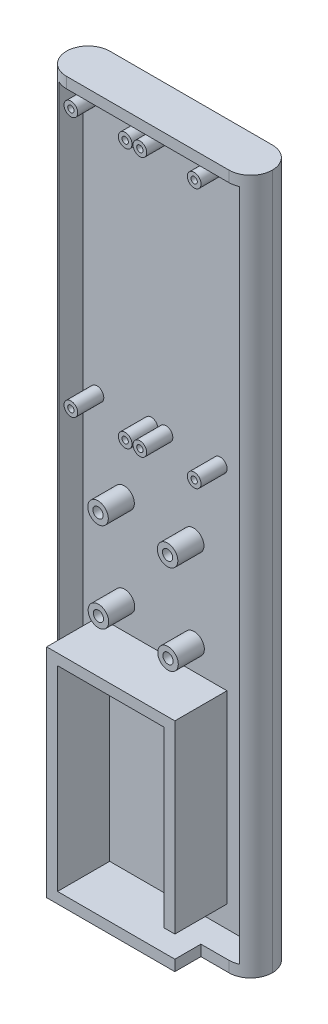
from build123d import *

# Parameters (mm, degrees)
SKETCH1_W           = 63.5
SKETCH1_H           = 203.2
BOSS_EXTRUDE1_DEPTH = 5.08
SKETCH2_R           = 2
SKETCH2_R_2         = 0.925
BOSS_EXTRUDE2_DEPTH = 7.62
BOSS_EXTRUDE3_DEPTH = 15.24
SKETCH4_W           = 3.175
SKETCH4_H           = 6.35
CUT_EXTRUDE1_DEPTH  = 15.24
SKETCH5_R           = 3
SKETCH5_R_2         = 1.5
BOSS_EXTRUDE4_DEPTH = 7.62
SKETCH8_W           = 63.5
SKETCH8_H           = 3.175
SKETCH8_W_2         = 15.305618657
SKETCH8_W_3         = 10.729381343
BOSS_EXTRUDE5_DEPTH = 7.62
SKETCH9_W           = 7.112
SKETCH9_H           = 203.2
CUT_EXTRUDE2_DEPTH  = 255.31730181
SKETCH10_W          = 3.556
SKETCH10_H          = 196.85
BOSS_EXTRUDE6_DEPTH = 7.62
SKETCH11_W          = 12.7
SKETCH11_H          = 203.2
BOSS_EXTRUDE7_DEPTH = 3.81
FILLET1_R           = 6.35


with BuildPart() as part:
    # Sketch1 → Boss-Extrude1 (new body)
    with BuildSketch(Plane.XY):
        with Locations((120.65, 101.6)):
            Rectangle(SKETCH1_W, SKETCH1_H)
    extrude(amount=BOSS_EXTRUDE1_DEPTH)

    # Sketch2 → Boss-Extrude2 (add)
    # profile 1 of 8: a face of its own
    with BuildSketch(Plane.XY.offset(5.08)):
        with Locations(Location((123.8316, 195.58, 0), (0, 0, 180))):
            Circle(SKETCH2_R)
        with Locations(Location((123.8316, 195.58, 0), (0, 0, 180))):
            Circle(SKETCH2_R_2, mode=Mode.SUBTRACT)
    # profile 2 of 8: a face of its own
    with BuildSketch(Plane.XY.offset(5.08)):
        with BuildLine():
            ThreePointArc((139.7, 193.58), (141.114213562, 196.994213562), (137.7, 195.58))
            ThreePointArc((137.7, 195.58), (138.285786438, 194.165786438), (139.7, 193.58))
        make_face()
        with Locations(Location((139.7, 195.58, 0), (0, 0, 180))):
            Circle(SKETCH2_R_2, mode=Mode.SUBTRACT)
    # profile 3 of 8: a face of its own
    with BuildSketch(Plane.XY.offset(5.08)):
        with BuildLine():
            ThreePointArc((125.8316, 119.6787), (125.245813562, 121.092913562), (123.8316, 121.6787))
            ThreePointArc((123.8316, 121.6787), (122.417386438, 118.264486438), (125.8316, 119.6787))
        make_face()
        with Locations(Location((123.8316, 119.6787, 0), (0, 0, 180))):
            Circle(SKETCH2_R_2, mode=Mode.SUBTRACT)
    # profile 4 of 8: a face of its own
    with BuildSketch(Plane.XY.offset(5.08)):
        with BuildLine():
            ThreePointArc((137.7, 119.6787), (141.114213562, 118.264486438), (139.7, 121.6787))
            ThreePointArc((139.7, 121.6787), (138.285786438, 121.092913562), (137.7, 119.6787))
        make_face()
        with Locations(Location((139.7, 119.6787, 0), (0, 0, 180))):
            Circle(SKETCH2_R_2, mode=Mode.SUBTRACT)
    # profile 5 of 8: a face of its own
    with BuildSketch(Plane.XY.offset(5.08)):
        with BuildLine():
            ThreePointArc((103.6632, 121.6787), (102.248986438, 118.264486438), (105.6632, 119.6787))
            ThreePointArc((105.6632, 119.6787), (105.077413562, 121.092913562), (103.6632, 121.6787))
        make_face()
        with Locations(Location((103.6632, 119.6787, 0), (0, 0, 180))):
            Circle(SKETCH2_R_2, mode=Mode.SUBTRACT)
    # profile 6 of 8: a face of its own
    with BuildSketch(Plane.XY.offset(5.08)):
        with BuildLine():
            ThreePointArc((119.5316, 121.6787), (118.117386438, 121.092913562), (117.5316, 119.6787))
            ThreePointArc((117.5316, 119.6787), (120.945813562, 118.264486438), (119.5316, 121.6787))
        make_face()
        with Locations(Location((119.5316, 119.6787, 0), (0, 0, 180))):
            Circle(SKETCH2_R_2, mode=Mode.SUBTRACT)
    # profile 7 of 8: a face of its own
    with BuildSketch(Plane.XY.offset(5.08)):
        with Locations(Location((103.6632, 195.58, 0), (0, 0, 180))):
            Circle(SKETCH2_R)
        with Locations(Location((103.6632, 195.58, 0), (0, 0, 180))):
            Circle(SKETCH2_R_2, mode=Mode.SUBTRACT)
    # profile 8 of 8: a face of its own
    with BuildSketch(Plane.XY.offset(5.08)):
        with BuildLine():
            ThreePointArc((117.5316, 195.58), (118.117386438, 194.165786438), (119.5316, 193.58))
            ThreePointArc((119.5316, 193.58), (120.945813562, 196.994213562), (117.5316, 195.58))
        make_face()
        with Locations(Location((119.5316, 195.58, 0), (0, 0, 180))):
            Circle(SKETCH2_R_2, mode=Mode.SUBTRACT)
    extrude(amount=BOSS_EXTRUDE2_DEPTH)

    # Sketch3 → Boss-Extrude3 (add)
    with BuildSketch(Plane.XY.offset(5.08)):
        Polygon((104.205618657, 0), (141.670618657, 0), (141.670618657, 63.5), (138.495618657, 60.325), (138.495618657, 3.175), (107.380618657, 3.175), align=None)
        Polygon((104.205618657, 63.5), (141.670618657, 63.5), (138.495618657, 60.325), (107.380618657, 60.325), (107.380618657, 3.175), (104.205618657, 0), align=None)
    extrude(amount=BOSS_EXTRUDE3_DEPTH)

    # Sketch4 → Cut-Extrude1 (cut)
    with BuildSketch(Plane.XY.offset(20.32)):
        with Locations((140.083118657, 6.35)):
            Rectangle(SKETCH4_W, SKETCH4_H)
    extrude(amount=-CUT_EXTRUDE1_DEPTH, mode=Mode.SUBTRACT)

    # Sketch5 → Boss-Extrude4 (add)
    # profile 1 of 4: a face of its own
    with BuildSketch(Plane.XY.offset(5.08)):
        with Locations(Location((131.925697663, 96.822110608, 0), (0, 0, 180))):
            Circle(SKETCH5_R)
        with Locations(Location((131.925697663, 96.822110608, 0), (0, 0, 180))):
            Circle(SKETCH5_R_2, mode=Mode.SUBTRACT)
    # profile 2 of 4: a face of its own
    with BuildSketch(Plane.XY.offset(5.08)):
        with Locations(Location((111.5974, 97.363063804, 0), (0, 0, 180))):
            Circle(SKETCH5_R)
        with Locations(Location((111.5974, 97.363063804, 0), (0, 0, 180))):
            Circle(SKETCH5_R_2, mode=Mode.SUBTRACT)
    # profile 3 of 4: a face of its own
    with BuildSketch(Plane.XY.offset(5.08)):
        with Locations(Location((111.715898312, 71.249338662, 0), (0, 0, 180))):
            Circle(SKETCH5_R)
        with Locations(Location((111.715898312, 71.249338662, 0), (0, 0, 180))):
            Circle(SKETCH5_R_2, mode=Mode.SUBTRACT)
    # profile 4 of 4: a face of its own
    with BuildSketch(Plane.XY.offset(5.08)):
        with Locations(Location((132.053845454, 70.708431036, 0), (0, 0, 180))):
            Circle(SKETCH5_R)
        with Locations(Location((132.053845454, 70.708431036, 0), (0, 0, 180))):
            Circle(SKETCH5_R_2, mode=Mode.SUBTRACT)
    extrude(amount=BOSS_EXTRUDE4_DEPTH)

    # Sketch8 → Boss-Extrude5 (add)
    with BuildSketch(Plane.XY.offset(5.08)):
        with Locations((120.65, 201.6125)):
            Rectangle(SKETCH8_W, SKETCH8_H)
        with Locations((96.552809329, 1.5875)):
            Rectangle(SKETCH8_W_2, SKETCH8_H)
        with Locations((147.035309329, 1.5875)):
            Rectangle(SKETCH8_W_3, SKETCH8_H)
    extrude(amount=BOSS_EXTRUDE5_DEPTH)

    # Sketch9 → Cut-Extrude2 (cut, through all)
    with BuildSketch(Plane.XY.offset(12.7)):
        with Locations((92.456, 101.6)):
            Rectangle(SKETCH9_W, SKETCH9_H)
    extrude(amount=-CUT_EXTRUDE2_DEPTH, mode=Mode.SUBTRACT)

    # Sketch10 → Boss-Extrude6 (add)
    with BuildSketch(Plane.XY.offset(5.08)):
        with Locations((97.79, 101.6)):
            Rectangle(SKETCH10_W, SKETCH10_H)
    extrude(amount=BOSS_EXTRUDE6_DEPTH)

    # Sketch11 → Boss-Extrude7 (add)
    with BuildSketch(Plane(origin=(152.4, 0, 0), x_dir=(0, 0, -1), z_dir=(1, 0, 0))):
        with Locations((-6.35, 101.6)):
            Rectangle(SKETCH11_W, SKETCH11_H)
    extrude(amount=BOSS_EXTRUDE7_DEPTH)

    # Fillet1
    # the kernel refuses this fillet: 6.35 mm, written as the material it takes off along each edge
    with BuildSketch(Plane(origin=(156.21, -15.875, 12.7), x_dir=(0, 0, -1), z_dir=(0, 1, 0))) as fillet1_piece_1:
        with BuildLine():
            CenterArc((FILLET1_R, FILLET1_R), FILLET1_R, 180, 90)
            Line((0, FILLET1_R), (0, 0))
            Line((0, 0), (FILLET1_R, 0))
        make_face()
    extrude(amount=234.95, mode=Mode.SUBTRACT)
    with BuildSketch(Plane(origin=(156.21, 219.075, 0), x_dir=(-1, 0, 0), z_dir=(0, -1, 0)), Plane(origin=(96.012, -15.875, 0), x_dir=(1, 0, 0), z_dir=(0, 1, 0))) as fillet1_piece_2:
        with BuildLine():
            CenterArc((FILLET1_R, -FILLET1_R), FILLET1_R, 90, 90)
            Line((0, -FILLET1_R), (0, 0))
            Line((0, 0), (FILLET1_R, 0))
        make_face()
    extrude(amount=234.95, mode=Mode.SUBTRACT)
    with BuildSketch(Plane(origin=(96.012, -15.875, 12.7), x_dir=(1, 0, 0), z_dir=(0, 1, 0))) as fillet1_piece_3_section:
        with BuildLine():
            CenterArc((FILLET1_R, FILLET1_R), FILLET1_R, 180, 90)
            Line((0, FILLET1_R), (0, 0))
            Line((0, 0), (FILLET1_R, 0))
        make_face()
    fillet1_piece_3 = extrude(amount=234.95, mode=Mode.PRIVATE)
    fillet1_piece_3 = fillet1_piece_3 - Plane(origin=(103.6632, 195.58, 12.507511293), x_dir=(-1, 0, 0), z_dir=(0, 0, -1)) * Cylinder(2, 496, mode=Mode.PRIVATE)
    fillet1_piece_3 = fillet1_piece_3 - Plane(origin=(103.6632, 119.6787, 12.507511293), x_dir=(1, 0, 0), z_dir=(0, 0, -1)) * Cylinder(2, 496, mode=Mode.PRIVATE)
    add(fillet1_piece_3, mode=Mode.SUBTRACT)


solid = part.part
